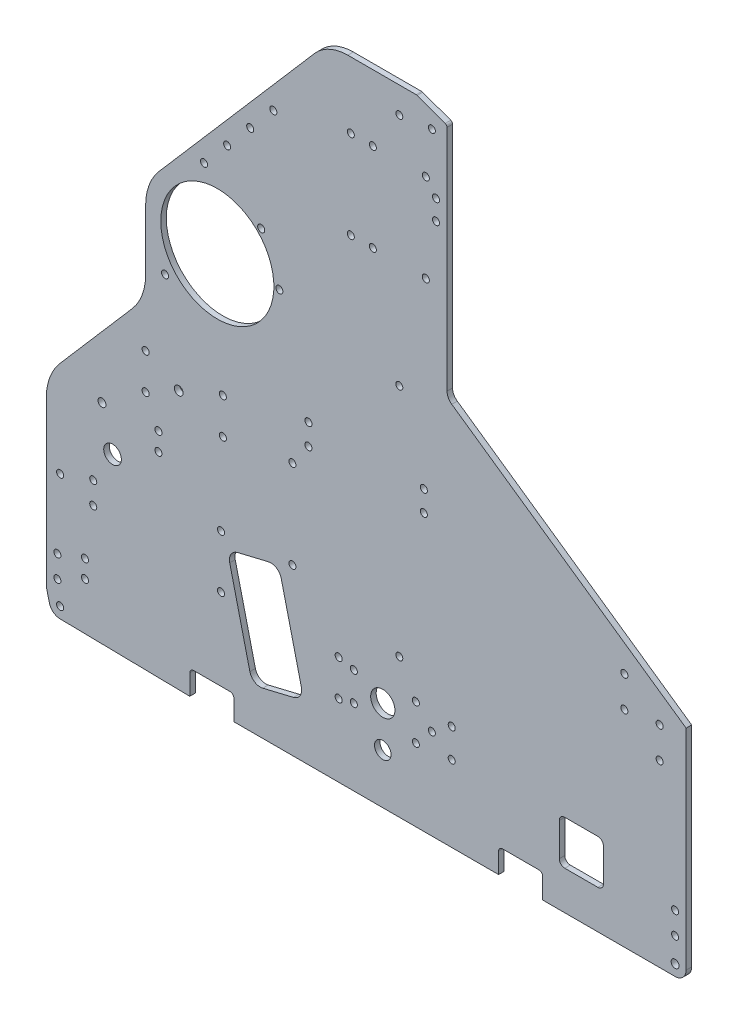
from build123d import *

# Parameters (mm, degrees)
SKETCH1_R           = 2.032
SKETCH1_R_2         = 5.08
SKETCH1_R_3         = 2.54
SKETCH1_R_4         = 2
BOSS_EXTRUDE1_DEPTH = 3.175
FILLET1_R           = 2.286
FILLET2_R           = 6.35
SKETCH2_R           = 2.032
CUT_EXTRUDE1_DEPTH  = 505.524983177
FILLET3_R           = 1.5875
SKETCH3_R           = 2.032
SKETCH3_R_2         = 2.286
CUT_EXTRUDE2_DEPTH  = 505.524983177
SKETCH4_R           = 2.032
SKETCH4_R_2         = 6.985
SKETCH4_R_3         = 4.7625
CUT_EXTRUDE3_DEPTH  = 505.524983177
SKETCH5_R           = 32.54375
SKETCH5_R_2         = 2.286000001
CUT_EXTRUDE5_DEPTH  = 505.524983177
FILLET4_R           = 31.75
CUT_EXTRUDE6_DEPTH  = 505.524983177
FILLET5_R           = 25.4
SKETCH8_R           = 2.031999999
SKETCH8_R_2         = 2.032
CUT_EXTRUDE7_DEPTH  = 505.524983177
SKETCH10_R          = 2.032000001
CUT_EXTRUDE8_DEPTH  = 505.524983177
FILLET6_R           = 6.35
SKETCH11_RX         = 2.032
SKETCH11_RY         = 2.031999502
CUT_EXTRUDE9_DEPTH  = 505.524983177


with BuildPart() as part:
    # Sketch1 → Boss-Extrude1 (new body)
    with BuildSketch(Plane.XY):
        with BuildLine():
            Line((7.829508682, -19.049081656), (82.55, -20.32))
            Line((82.55, -20.32), (82.55, -6.35))
            Line((82.55, -6.35), (107.95, -6.35))
            Line((107.95, -6.35), (107.95, -20.32))
            Line((107.95, -20.32), (260.35, -20.32))
            Line((260.35, -20.32), (260.35, -6.35))
            Line((260.35, -6.35), (285.75, -6.35))
            Line((285.75, -6.35), (285.75, -20.32))
            Line((285.75, -20.32), (368.3, -20.32))
            Line((368.3, -20.32), (368.3, 106.68))
            Line((368.3, 106.68), (230.66375, 202.565))
            Line((230.66375, 202.565), (230.66375, 338.455))
            Line((230.66375, 338.455), (213.19998, 344.805))
            Line((213.19998, 344.805), (203.2, 344.805))
            Line((203.2, 344.805), (161.925, 344.805))
            Line((161.925, 344.805), (52.720122664, 218.469945827))
            ThreePointArc((52.720122664, 218.469945827), (52.803835479, 218.142145922), (52.832, 217.805))
            ThreePointArc((52.832, 217.805), (52.095493096, 216.239521914), (50.419872403, 215.808871996))
            Line((50.419872403, 215.808871996), (0, 157.48))
            Line((0, 157.48), (0, 0))
            Line((0, 0), (0, -6.35))
            ThreePointArc((0, -6.35), (0.047577015, -7.125863724), (0.189595124, -7.890101219))
            Line((0.189595124, -7.890101219), (1.777095124, -14.240101219))
            ThreePointArc((1.777095124, -14.240101219), (3.987212552, -17.671692778), (7.829508682, -19.049081656))
        make_face()
        with Locations((7.9375, -12.7)):
            Circle(SKETCH1_R, mode=Mode.SUBTRACT)
        with Locations((6.35, 0)):
            Circle(SKETCH1_R, mode=Mode.SUBTRACT)
        with Locations((6.35, 12.7)):
            Circle(SKETCH1_R, mode=Mode.SUBTRACT)
        with Locations((38.1, 78.105)):
            Circle(SKETCH1_R_2, mode=Mode.SUBTRACT)
        with Locations((57.15, 118.58625)):
            Circle(SKETCH1_R, mode=Mode.SUBTRACT)
        with Locations((57.15, 139.22375)):
            Circle(SKETCH1_R, mode=Mode.SUBTRACT)
        with Locations((76.2, 128.905)):
            Circle(SKETCH1_R_3, mode=Mode.SUBTRACT)
        with Locations((101.6, 118.58625)):
            Circle(SKETCH1_R, mode=Mode.SUBTRACT)
        with Locations((101.6, 139.22375)):
            Circle(SKETCH1_R, mode=Mode.SUBTRACT)
        with Locations((203.2, 59.805)):
            Circle(SKETCH1_R_4, mode=Mode.SUBTRACT)
        with Locations((361.95, 0)):
            Circle(SKETCH1_R, mode=Mode.SUBTRACT)
        with Locations((361.95, 12.7)):
            Circle(SKETCH1_R, mode=Mode.SUBTRACT)
        with Locations((353.06, 82.955052336)):
            Circle(SKETCH1_R, mode=Mode.SUBTRACT)
        with Locations((332.74, 98.195052336)):
            Circle(SKETCH1_R, mode=Mode.SUBTRACT)
        with Locations((332.74, 115.975052336)):
            Circle(SKETCH1_R, mode=Mode.SUBTRACT)
        with Locations((353.06, 100.735052336)):
            Circle(SKETCH1_R, mode=Mode.SUBTRACT)
        with Locations((68.326, 182.923674932)):
            Circle(SKETCH1_R, mode=Mode.SUBTRACT)
        with Locations((76.2, 217.805)):
            Circle(SKETCH1_R, mode=Mode.SUBTRACT)
        with Locations((90.779500502, 249.682)):
            Circle(SKETCH1_R, mode=Mode.SUBTRACT)
        with Locations((104.067838673, 265.054783374)):
            Circle(SKETCH1_R, mode=Mode.SUBTRACT)
        with Locations((117.356176844, 280.427566748)):
            Circle(SKETCH1_R, mode=Mode.SUBTRACT)
        with Locations((130.644515014, 295.800350122)):
            Circle(SKETCH1_R, mode=Mode.SUBTRACT)
        with Locations((203.2, 194.805)):
            Circle(SKETCH1_R_4, mode=Mode.SUBTRACT)
        with Locations((224.31375, 287.401)):
            Circle(SKETCH1_R, mode=Mode.SUBTRACT)
        with Locations((224.31375, 298.831)):
            Circle(SKETCH1_R, mode=Mode.SUBTRACT)
        with Locations((203.2, 329.805)):
            Circle(SKETCH1_R_4, mode=Mode.SUBTRACT)
        with Locations((221.931865, 332.105)):
            Circle(SKETCH1_R_4, mode=Mode.SUBTRACT)
    extrude(amount=BOSS_EXTRUDE1_DEPTH)

    # Fillet1
    fillet1_edges = [part.edges().sort_by_distance(p)[0] for p in [
        (285.75, -6.35, 1.5875),
        (107.95, -6.35, 1.5875),
        (260.35, -6.35, 1.5875),
        (82.55, -6.35, 1.5875),
    ]]
    fillet(fillet1_edges, radius=FILLET1_R)

    # Fillet2
    fillet2_edges = [part.edges().sort_by_distance(p)[0] for p in [
        (230.66375, 202.565, 1.5875),
    ]]
    fillet(fillet2_edges, radius=FILLET2_R)

    # Sketch2 → Cut-Extrude1 (cut, through all)
    with BuildSketch(Plane(origin=(0, 0, 0), x_dir=(-1, 0, 0), z_dir=(0, 0, -1))):
        with Locations((-100.552770272, 71.086035298)):
            Circle(SKETCH2_R)
        with Locations((-100.552770272, 40.606035298)):
            Circle(SKETCH2_R)
        with Locations((-22.225, 18.202541089)):
            Circle(SKETCH2_R)
        with Locations((-22.225, 8.042541089)):
            Circle(SKETCH2_R)
    extrude(amount=-CUT_EXTRUDE1_DEPTH, mode=Mode.SUBTRACT)

    # Fillet3
    fillet3_edges = [part.edges().sort_by_distance(p)[0] for p in [
        (230.66375, 338.455, 1.5875),
        (213.19998, 344.805, 1.5875),
    ]]
    fillet(fillet3_edges, radius=FILLET3_R)

    # Sketch3 → Cut-Extrude2 (cut, through all)
    with BuildSketch(Plane.XY.offset(3.175)):
        with BuildLine():
            Line((127.789350211, 69.359774106), (110.090750339, 65.117184968))
            ThreePointArc((110.090750339, 65.117184968), (106.287939856, 62.356288953), (105.55119507, 57.715047577))
            Line((105.55119507, 57.715047577), (117.160037875, 9.287010566))
            ThreePointArc((117.160037875, 9.287010566), (119.92093389, 5.484200083), (124.562175266, 4.747455297))
            Line((124.562175266, 4.747455297), (142.260775137, 8.990044434))
            ThreePointArc((142.260775137, 8.990044434), (146.063585621, 11.75094045), (146.800330407, 16.392181825))
            Line((146.800330407, 16.392181825), (135.191487602, 64.820218836))
            ThreePointArc((135.191487602, 64.820218836), (132.430591586, 68.62302932), (127.789350211, 69.359774106))
        make_face()
        with Locations((26.987500002, 46.953113935)):
            Circle(SKETCH3_R)
        with Locations((26.987500002, 59.653113935)):
            Circle(SKETCH3_R)
        with Locations((7.937500002, 53.303113935)):
            Circle(SKETCH3_R)
        with Locations((32.030600738, 100.810868776)):
            Circle(SKETCH3_R_2)
        with Locations((64.525942114, 102.94048958)):
            Circle(SKETCH3_R)
        with Locations((64.525942114, 92.525786339)):
            Circle(SKETCH3_R)
        with Locations((134.14375, 208.228121768)):
            Circle(SKETCH3_R)
        with Locations((123.681970341, 233.485092108)):
            Circle(SKETCH3_R)
    extrude(amount=-CUT_EXTRUDE2_DEPTH, mode=Mode.SUBTRACT)

    # Sketch4 → Cut-Extrude3 (cut, through all)
    with BuildSketch(Plane.XY.offset(3.175)):
        with Locations((168.275, 42.06875)):
            Circle(SKETCH4_R)
        with Locations((212.725, 42.06875)):
            Circle(SKETCH4_R)
        with Locations((212.725, 21.43125)):
            Circle(SKETCH4_R)
        with Locations((168.275, 21.43125)):
            Circle(SKETCH4_R)
        with Locations((193.675, 31.75)):
            Circle(SKETCH4_R_2)
        with Locations((177.00498, 40.0431)):
            Circle(SKETCH4_R)
        with Locations((177.00498, 23.4569)):
            Circle(SKETCH4_R)
        with Locations((193.675, 8.466666658)):
            Circle(SKETCH4_R_3)
        with Locations((221.931865, 31.75)):
            Circle(SKETCH4_R)
        with Locations((233.36123, 23.4569)):
            Circle(SKETCH4_R)
        with Locations((233.36123, 40.0431)):
            Circle(SKETCH4_R)
    extrude(amount=-CUT_EXTRUDE3_DEPTH, mode=Mode.SUBTRACT)

    # Sketch5 → Cut-Extrude5 (cut, through all)
    with BuildSketch(Plane(origin=(0, 0, 0), x_dir=(-1, 0, 0), z_dir=(0, 0, -1))):
        Polygon((0, 157.48), (-57.15, 223.594705882), (-57.15, 165.333696112), (0, 99.218990229), align=None)
        with Locations((-98.425, 208.228121768)):
            Circle(SKETCH5_R)
        with Locations((-361.95, -13.97)):
            Circle(SKETCH5_R_2)
    extrude(amount=-CUT_EXTRUDE5_DEPTH, mode=Mode.SUBTRACT)

    # Fillet4
    fillet4_edges = [part.edges().sort_by_distance(p)[0] for p in [
        (0, 99.218990229, 1.5875),
        (57.15, 165.333696112, 1.5875),
        (57.15, 223.594705882, 1.5875),
    ]]
    fillet(fillet4_edges, radius=FILLET4_R)

    # Sketch6 → Cut-Extrude6 (cut, through all)
    with BuildSketch(Plane.XY.offset(3.175)):
        with BuildLine():
            Line((298.45, 27.305), (317.5, 27.305))
            ThreePointArc((317.5, 27.305), (319.74506403, 26.37506403), (320.675, 24.13))
            Line((320.675, 24.13), (320.675, 5.08))
            ThreePointArc((320.675, 5.08), (319.74506403, 2.83493597), (317.5, 1.905))
            Line((317.5, 1.905), (298.45, 1.905))
            ThreePointArc((298.45, 1.905), (296.20493597, 2.83493597), (295.275, 5.08))
            Line((295.275, 5.08), (295.275, 24.13))
            ThreePointArc((295.275, 24.13), (296.20493597, 26.37506403), (298.45, 27.305))
        make_face()
    extrude(amount=-CUT_EXTRUDE6_DEPTH, mode=Mode.SUBTRACT)

    # Fillet5
    fillet5_edges = [part.edges().sort_by_distance(p)[0] for p in [
        (161.925, 344.805, 1.5875),
    ]]
    fillet(fillet5_edges, radius=FILLET5_R)

    # Sketch8 → Cut-Extrude7 (cut, through all)
    with BuildSketch(Plane(origin=(0, 0, 0), x_dir=(-1, 0, 0), z_dir=(0, 0, -1))):
        with Locations((-187.96, 306.70500001)):
            Circle(SKETCH8_R)
        with Locations((-175.26, 306.70500001)):
            Circle(SKETCH8_R_2)
        with Locations((-218.44, 306.704999997)):
            Circle(SKETCH8_R_2)
        with Locations((-218.44, 255.904999997)):
            Circle(SKETCH8_R_2)
        with Locations((-187.96, 255.90500001)):
            Circle(SKETCH8_R)
        with Locations((-175.26, 255.90500001)):
            Circle(SKETCH8_R_2)
    extrude(amount=-CUT_EXTRUDE7_DEPTH, mode=Mode.SUBTRACT)

    # Sketch10 → Cut-Extrude8 (cut, through all)
    with BuildSketch(Plane.XY.offset(3.175)):
        with Locations((141.642479999, 74.684371768)):
            Circle(SKETCH10_R)
        with Locations((141.642479999, 125.484371768)):
            Circle(SKETCH10_R)
    extrude(amount=-CUT_EXTRUDE8_DEPTH, mode=Mode.SUBTRACT)

    # Fillet6
    fillet6_edges = [part.edges().sort_by_distance(p)[0] for p in [
        (368.3, -20.32, 1.5875),
    ]]
    fillet(fillet6_edges, radius=FILLET6_R)

    # Sketch11 → Cut-Extrude9 (cut, through all)
    with BuildSketch(Plane.XY.offset(3.175)):
        with Locations(Location((150.881424454, 138.43), (0, 0, 90))):
            Ellipse(SKETCH11_RX, SKETCH11_RY)
        with Locations(Location((150.881424454, 150.495), (0, 0, 90))):
            Ellipse(SKETCH11_RX, SKETCH11_RY)
        with Locations(Location((217.30240818, 150.495), (0, 0, 90))):
            Ellipse(SKETCH11_RX, SKETCH11_RY)
        with Locations(Location((217.30240818, 138.43), (0, 0, 90))):
            Ellipse(SKETCH11_RX, SKETCH11_RY)
    extrude(amount=-CUT_EXTRUDE9_DEPTH, mode=Mode.SUBTRACT)


solid = part.part
